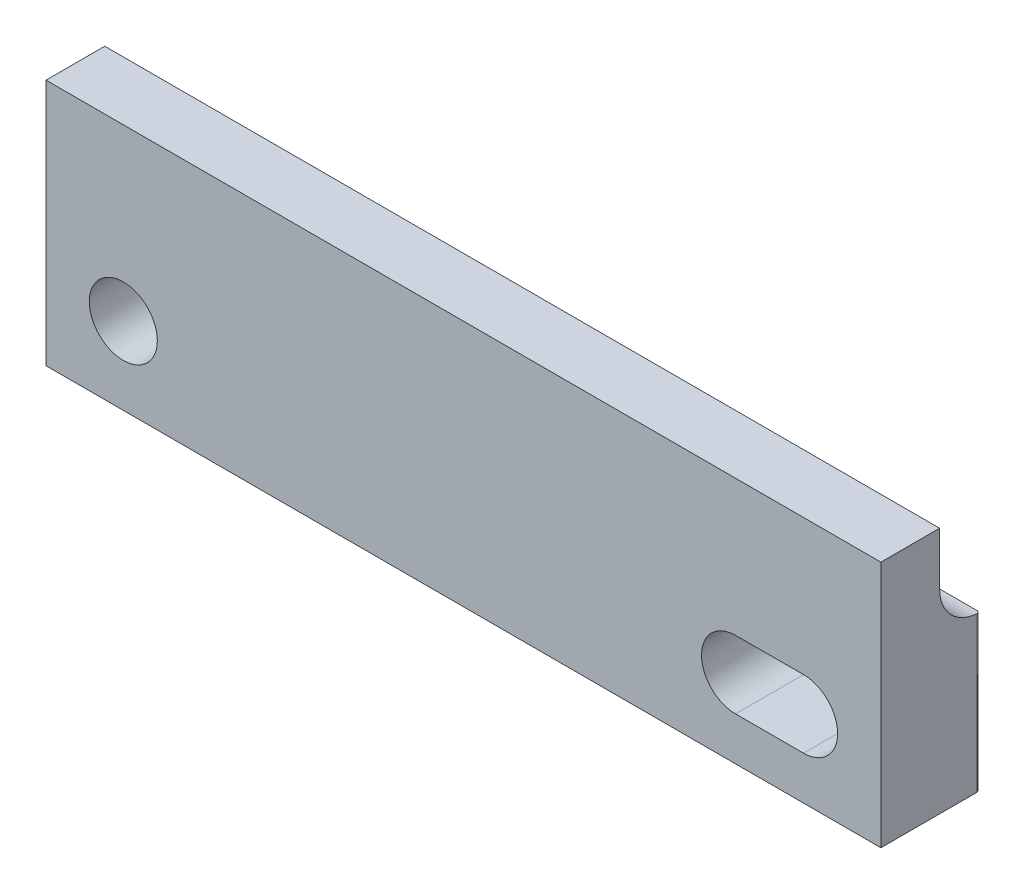
from build123d import *

# Parameters (mm, degrees)
SKETCH_1_W          = 270
SKETCH_1_H          = 80
EXTRUDE_1_DEPTH     = 32
SKETCH_2_R          = 11
CUT_EXTRUDE_1_DEPTH = 284.414890223
CUT_EXTRUDE_2_DEPTH = 284.414890223
FILLET_1_R          = 1
FILLET_2_R          = 1
FILLET_4_R          = 1


with BuildPart() as part:
    # 草图1 → 拉伸1 (new body)
    with BuildSketch(Plane.XY):
        with Locations((135, 40)):
            Rectangle(SKETCH_1_W, SKETCH_1_H)
    extrude(amount=EXTRUDE_1_DEPTH)

    # 草图2 → 切除-拉伸1 (cut, through all)
    with BuildSketch(Plane.XY.offset(32)):
        with Locations((25, 25)):
            Circle(SKETCH_2_R)
        with BuildLine():
            Line((223, 36), (245, 36))
            ThreePointArc((245, 36), (256, 25), (245, 14))
            Line((245, 14), (223, 14))
            ThreePointArc((223, 14), (212, 25), (223, 36))
        make_face()
    extrude(amount=-CUT_EXTRUDE_1_DEPTH, mode=Mode.SUBTRACT)

    # 草图3 → 切除-拉伸2 (cut, through all)
    with BuildSketch(Plane.ZY):
        with BuildLine():
            Line((13, 80), (13, 63))
            ThreePointArc((13, 63), (9.192388155, 53.807611845), (0, 50))
            Line((0, 50), (0, 80))
            Line((0, 80), (13, 80))
        make_face()
    extrude(amount=-CUT_EXTRUDE_2_DEPTH, mode=Mode.SUBTRACT)

    # 圆角1
    fillet_1_edges = [part.edges().sort_by_distance(p)[0] for p in [
        (270, 25, 0),
    ]]
    fillet(fillet_1_edges, radius=FILLET_1_R)

    # 圆角2
    fillet_2_edges = [part.edges().sort_by_distance(p)[0] for p in [
        (0, 25, 0),
    ]]
    fillet(fillet_2_edges, radius=FILLET_2_R)

    # 圆角4
    # the kernel refuses this fillet: 1 mm, written as the material it takes off along each edge
    with BuildSketch(Plane(origin=(-1.5, 0, 0), x_dir=(0, 0, 1), z_dir=(1, 0, 0))) as fillet_4_piece_1:
        with BuildLine():
            CenterArc((FILLET_4_R, -FILLET_4_R), FILLET_4_R, 90, 90)
            Line((0, -FILLET_4_R), (0, 0))
            Line((0, 0), (FILLET_4_R, 0))
        make_face()
    extrude(amount=273, mode=Mode.SUBTRACT)


solid = part.part
